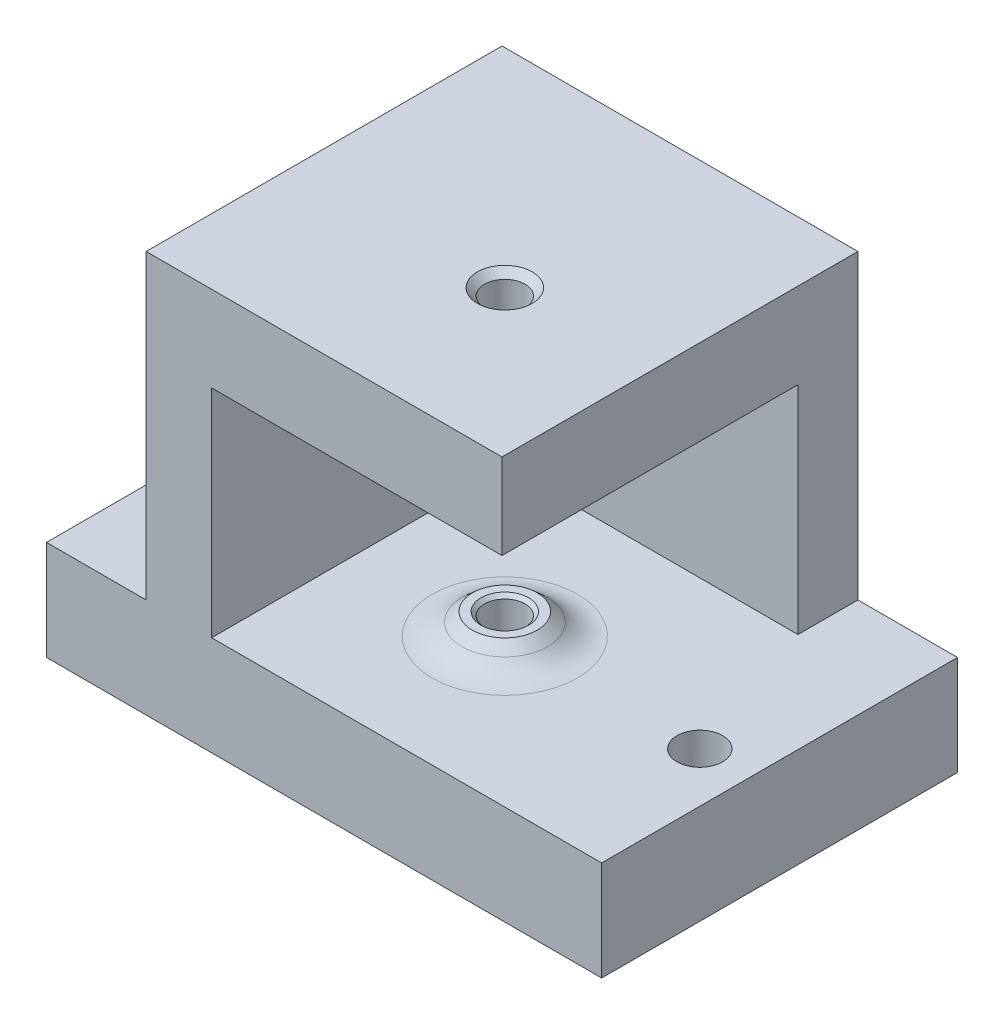
from build123d import *

# Parameters (mm, degrees)
SKETCH1_W               = 25
SKETCH1_H               = 25
BOSS_EXTRUDE1_DEPTH     = 7
BOSS_EXTRUDE2_DEPTH     = 15.2
SKETCH3_W               = 25
SKETCH3_H               = 25
BOSS_EXTRUDE3_DEPTH     = 6
CUT_EXTRUDE1_DEPTH      = 28.603260677
CUT_EXTRUDE1_DEPTH_BACK = 28.603260677
SKETCH4_R               = 1.425
SKETCH5_R               = 2.5
SKETCH5_R_2             = 1.425
BOSS_EXTRUDE4_DEPTH     = 1.5
BOSS_EXTRUDE5_START     = 1.5
SKETCH6_R               = 2.5
SKETCH6_R_2             = 1.425
BOSS_EXTRUDE5_DEPTH     = 1.5
FILLET1_R               = 3
CHAMFER2_SIZE           = 0.25
CHAMFER3_SIZE           = 0.5
SKETCH8_W               = 7
SKETCH8_H               = 25
SKETCH8_R               = 1.6
BOSS_EXTRUDE6_DEPTH     = 7


with BuildPart() as part:
    # Sketch1 → Boss-Extrude1 (new body)
    with BuildSketch(Plane(origin=(0, 0, 0), x_dir=(1, 0, 0), z_dir=(0, 1, 0))):
        Rectangle(SKETCH1_W, SKETCH1_H)
    extrude(amount=BOSS_EXTRUDE1_DEPTH)

    # Sketch2 → Boss-Extrude2 (add)
    with BuildSketch(Plane(origin=(0, 7, 0), x_dir=(1, 0, 0), z_dir=(0, 1, 0))):
        Polygon((-12.5, -12.5), (-7.897681384, -12.5), (-7.897681384, 8.291292288), (12.5, 8.291292288), (12.5, 12.5), (-12.5, 12.5), align=None)
    extrude(amount=BOSS_EXTRUDE2_DEPTH)

    # Sketch3 → Boss-Extrude3 (add)
    with BuildSketch(Plane(origin=(0, 22.2, 0), x_dir=(1, 0, 0), z_dir=(0, 1, 0))):
        Rectangle(SKETCH3_W, SKETCH3_H)
    extrude(amount=BOSS_EXTRUDE3_DEPTH)

    # Sketch4 → Cut-Extrude1 (cut, two sides: drawn at the far end of the back side and taken through both)
    with BuildSketch(Plane(origin=(0, 7, 0), x_dir=(1, 0, 0), z_dir=(0, 1, 0)).offset(-CUT_EXTRUDE1_DEPTH_BACK)):
        with Locations(Location((2.301159308, -2.104353856, 0), (0, 0, 270))):
            Circle(SKETCH4_R)
    extrude(amount=CUT_EXTRUDE1_DEPTH + CUT_EXTRUDE1_DEPTH_BACK, mode=Mode.SUBTRACT)

    # Sketch5 → Boss-Extrude4 (add)
    with BuildSketch(Plane(origin=(0, 7, 0), x_dir=(1, 0, 0), z_dir=(0, 1, 0))):
        with Locations(Location((2.301159308, -2.104353856, 0), (0, 0, 90))):
            Circle(SKETCH5_R)
        with Locations(Location((2.301159308, -2.104353856, 0), (0, 0, 270))):
            Circle(SKETCH5_R_2, mode=Mode.SUBTRACT)
    extrude(amount=BOSS_EXTRUDE4_DEPTH)

    # Sketch6 → Boss-Extrude5 (add)
    with BuildSketch(Plane.XZ.offset(-22.2).offset(BOSS_EXTRUDE5_START)):
        with Locations(Location((2.301159308, 2.104353856, 0), (0, 0, 270))):
            Circle(SKETCH6_R)
        with Locations(Location((2.301159308, 2.104353856, 0), (0, 0, 90))):
            Circle(SKETCH6_R_2, mode=Mode.SUBTRACT)
    extrude(amount=-BOSS_EXTRUDE5_DEPTH)

    # Fillet1
    # the kernel refuses this fillet: 3 mm, written as the material it adds along each edge
    with BuildSketch(Plane(origin=(2.301159308, 7, 2.104353856), x_dir=(0, 0, -1), z_dir=(1, 0, 0))) as fillet1_piece_1:
        with BuildLine():
            CenterArc((5.098076211, 3), FILLET1_R, 210, 60)
            Line((2.5, 1.5), (2.448038476, 1.47))
            ThreePointArc((2.448038476, 1.47), (2.44, 0.75), (2.44, 0))
            Line((2.44, 0), (2.5, -0.06))
            Line((2.5, -0.06), (5.098076211, -0.06))
            Line((5.098076211, -0.06), (5.098076211, 0))
        make_face()
    revolve(axis=Axis((2.301159308, 7, 2.104353856), (0, 1, 0)))
    with BuildSketch(Plane(origin=(2.301159308, 22.2, 2.104353856), x_dir=(0, 0, -1), z_dir=(-1, 0, 0))) as fillet1_piece_2:
        with BuildLine():
            CenterArc((5.098076211, 3), FILLET1_R, 210, 60)
            Line((2.5, 1.5), (2.448038476, 1.47))
            ThreePointArc((2.448038476, 1.47), (2.44, 0.75), (2.44, 0))
            Line((2.44, 0), (2.5, -0.06))
            Line((2.5, -0.06), (5.098076211, -0.06))
            Line((5.098076211, -0.06), (5.098076211, 0))
        make_face()
    revolve(axis=Axis((2.301159308, 22.2, 2.104353856), (0, -1, 0)))

    # Chamfer1
    # the kernel refuses this chamfer: 1, 0.396795558 mm, written as the material it takes off along each edge
    with BuildSketch(Plane(origin=(2.301159308, 8.5, 2.104353856), x_dir=(0, 0, -1), z_dir=(1, 0, 0))) as chamfer1_piece_1:
        with BuildLine():
            Line((2.245190561, 0.026572252), (3.029375179, -0.670372697))
            Line((3.029375179, -0.670372697), (3.043365842, -0.656080694))
            ThreePointArc((3.043365842, -0.656080694), (2.755730305, -0.342231162), (2.517320508, 0.01))
            Line((2.517320508, 0.01), (2.5, 0.02))
            ThreePointArc((2.5, 0.02), (2.37259528, 0.02), (2.245190561, 0.046572252))
            Line((2.245190561, 0.046572252), (2.245190561, 0.026572252))
        make_face()
    revolve(axis=Axis((2.301159308, 8.5, 2.104353856), (0, 1, 0)), mode=Mode.SUBTRACT)
    with BuildSketch(Plane(origin=(2.301159308, 20.7, 2.104353856), x_dir=(0, 0, -1), z_dir=(-1, 0, 0))) as chamfer1_piece_2:
        with BuildLine():
            Line((3.029375179, -0.670372697), (2.245190561, 0.026572252))
            Line((2.245190561, 0.026572252), (2.245190561, 0.046572252))
            ThreePointArc((2.245190561, 0.046572252), (2.37259528, 0.02), (2.5, 0.02))
            Line((2.5, 0.02), (2.517320508, 0.01))
            ThreePointArc((2.517320508, 0.01), (2.755730305, -0.342231162), (3.043365842, -0.656080694))
            Line((3.043365842, -0.656080694), (3.029375179, -0.670372697))
        make_face()
    revolve(axis=Axis((2.301159308, 20.7, 2.104353856), (0, -1, 0)), mode=Mode.SUBTRACT)

    # Chamfer2
    chamfer2_edges = [part.edges().sort_by_distance(p)[0] for p in [
        (2.301159308, 8.5, 0.679353856),
        (2.301159308, 20.7, 0.679353856),
    ]]
    chamfer(chamfer2_edges, length=CHAMFER2_SIZE)

    # Chamfer3
    chamfer3_edges = [part.edges().sort_by_distance(p)[0] for p in [
        (2.301159308, 0, 0.679353856),
        (2.301159308, 28.2, 0.679353856),
    ]]
    chamfer(chamfer3_edges, length=CHAMFER3_SIZE)

    # Sketch8 → Boss-Extrude6 (add)
    # profile 1 of 2: a face of its own
    with BuildSketch(Plane(origin=(0, 0, 0), x_dir=(1, 0, 0), z_dir=(0, 1, 0))):
        with Locations((16, 0)):
            Rectangle(SKETCH8_W, SKETCH8_H)
        with Locations(Location((16, -2.104353856, 0), (0, 0, 90))):
            Circle(SKETCH8_R, mode=Mode.SUBTRACT)
    # profile 2 of 2: a face of its own
    with BuildSketch(Plane(origin=(0, 0, 0), x_dir=(1, 0, 0), z_dir=(0, 1, 0))):
        with Locations((-16, 0)):
            Rectangle(SKETCH8_W, SKETCH8_H)
        with Locations(Location((-16, -2.104353856, 0), (0, 0, 90))):
            Circle(SKETCH8_R, mode=Mode.SUBTRACT)
    extrude(amount=BOSS_EXTRUDE6_DEPTH)


solid = part.part
